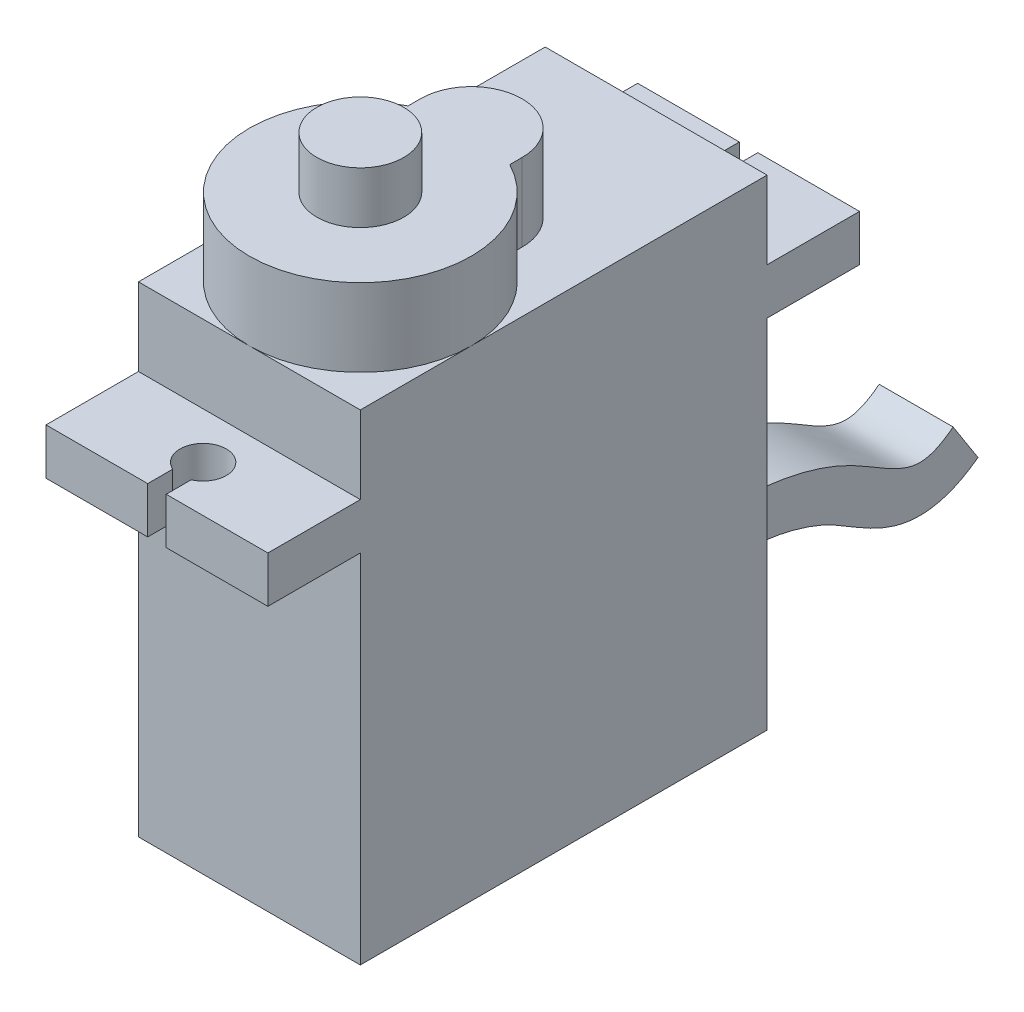
from build123d import *

# Parameters (mm, degrees)
EXTRUDE_1_DEPTH     = 6
EXTRUDE_2_DEPTH     = 4.2
SKETCH_3_R          = 2.35
EXTRUDE_3_DEPTH     = 2.8
SWEEP_START         = -2
SWEEP_1_DEPTH       = 4
CUT_EXTRUDE_1_DEPTH = 3


# Read off the part's stored shape, not the designer's step: По траектории1
with BuildPart() as part:
    # Эскиз1 → Бобышка-Вытянуть1 (new, symmetric)
    with BuildSketch(Plane(origin=(0, 0, 0), x_dir=(0, 0, -1), z_dir=(1, 0, 0))):
        Polygon((0, 0), (22, 0), (22, 19.3), (27, 19.3), (27, 21.8), (22, 21.8), (22, 26), (0, 26), (0, 21.8), (-5, 21.8), (-5, 19.3), (0, 19.3), align=None)
    extrude(amount=EXTRUDE_1_DEPTH, both=True)

    # Эскиз2 → Бобышка-Вытянуть2 (add)
    with BuildSketch(Plane(origin=(0, 26, 0), x_dir=(1, 0, 0), z_dir=(0, 1, 0))):
        with BuildLine():
            Line((-2.75, 12), (-2.75, 11.332682252))
            ThreePointArc((-2.75, 11.332682252), (0, 0), (2.75, 11.332682252))
            Line((2.75, 11.332682252), (2.75, 12))
            ThreePointArc((2.75, 12), (0, 14.75), (-2.75, 12))
        make_face()
    extrude(amount=EXTRUDE_2_DEPTH)

    # Эскиз3 → Бобышка-Вытянуть3 (add)
    with BuildSketch(Plane(origin=(0, 30.2, 0), x_dir=(1, 0, 0), z_dir=(0, 1, 0))):
        with Locations(Location((0, 6, 0), (0, 0, 270))):
            Circle(SKETCH_3_R)
    extrude(amount=EXTRUDE_3_DEPTH)

    # По траектории1 outline → По траектории1 (add)
    with BuildSketch(Plane.YZ.offset(SWEEP_START)):
        with BuildLine():
            Line((7.5, -22), (5, -22))
            add(Edge.make_bspline(
                [(5, -22), (5.069741994, -22.788251561), (5.125958635, -24.404153677), (4.878573381, -26.772120173), (4.395772619, -28.378294328), (3.83166606, -29.588406839), (3.21879889, -30.61604033), (2.403361035, -31.959681467), (1.936450048, -33.447187834), (1.879246473, -34.586937516), (2.09656871, -35.628227488), (2.472597261, -36.523725644), (2.84782964, -37.107918611), (3.067609014, -37.407797225)],
                knots=[0, 0, 0, 0, 0.166666667, 0.333333333, 0.5, 0.534253468, 0.625, 0.75, 0.8125, 0.875, 0.916666667, 0.958333333, 1, 1, 1, 1], degree=3))
            Line((3.067609014, -37.407797225), (5.173227765, -36.060069628))
            add(Edge.make_bspline(
                [(7.5, -22), (7.567173372, -22.882492449), (7.618252767, -24.686876341), (7.299304344, -27.455245749), (6.663696491, -29.460064755), (5.924563706, -30.955136787), (5.18985295, -32.152025941), (4.582294135, -33.24339685), (4.389602767, -34.062522123), (4.406362916, -34.546823904), (4.535371286, -35.013924669), (4.759350216, -35.482390845), (5.013826459, -35.862321947), (5.173227765, -36.060069628)],
                knots=[0, 0, 0, 0, 0.166666667, 0.333333333, 0.5, 0.534253468, 0.625, 0.75, 0.8125, 0.875, 0.916666667, 0.958333333, 1, 1, 1, 1], degree=3))
        make_face()
    extrude(amount=SWEEP_1_DEPTH)

    # Эскиз6 → Вырез-Вытянуть1 (cut)
    with BuildSketch(Plane(origin=(0, 21.8, 0), x_dir=(1, 0, 0), z_dir=(0, 1, 0))):
        with BuildLine():
            Line((-0.5, 27), (-0.5, 25.645643924))
            ThreePointArc((-0.5, 25.645643924), (0, 23.25), (0.5, 25.645643924))
            Line((0.5, 25.645643924), (0.5, 27))
            Line((0.5, 27), (0, 27))
            Line((0, 27), (-0.5, 27))
        make_face()
        with BuildLine():
            Line((0.5, -5), (0.5, -3.645643924))
            ThreePointArc((0.5, -3.645643924), (0, -1.25), (-0.5, -3.645643924))
            Line((-0.5, -3.645643924), (-0.5, -5))
            Line((-0.5, -5), (0, -5))
            Line((0, -5), (0.5, -5))
        make_face()
    extrude(amount=-CUT_EXTRUDE_1_DEPTH, mode=Mode.SUBTRACT)


solid = part.part
